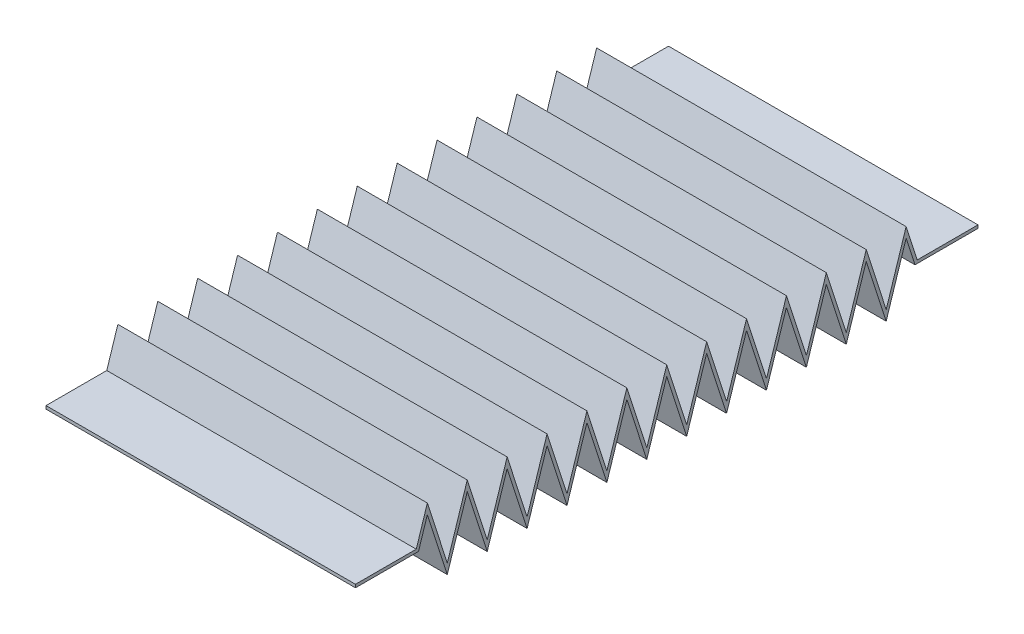
from build123d import *

# Parameters (mm, degrees)
EXTRUDE_THIN1_DEPTH = 25


with BuildPart() as part:
    # Sketch3 → Extrude-Thin1 (new, symmetric)
    with BuildSketch(Plane(origin=(0, 0, 0), x_dir=(0, 0, -1), z_dir=(1, 0, 0))):
        Polygon((0, 4.75), (10.182089669, 4.75), (11.611478161, 9.185022846), (14.834434482, -0.814977154), (18.057390803, 9.185022846), (21.280347124, -0.814977154), (24.503303445, 9.185022846), (27.726259766, -0.814977154), (30.949216087, 9.185022846), (34.172172408, -0.814977154), (37.395128729, 9.185022846), (40.61808505, -0.814977154), (43.841041371, 9.185022846), (47.063997692, -0.814977154), (50.286954014, 9.185022846), (53.509910335, -0.814977154), (56.732866656, 9.185022846), (59.955822977, -0.814977154), (63.178779298, 9.185022846), (66.401735619, -0.814977154), (69.62469194, 9.185022846), (72.847648261, -0.814977154), (76.070604582, 9.185022846), (79.293560903, -0.814977154), (82.516517224, 9.185022846), (85.739473545, -0.814977154), (88.962429867, 9.185022846), (90.391818358, 4.75), (100.573908027, 4.75), (100.573908027, 5.25), (90.755997696, 5.25), (88.962429867, 10.814977154), (85.739473545, 0.814977154), (82.516517224, 10.814977154), (79.293560903, 0.814977154), (76.070604582, 10.814977154), (72.847648261, 0.814977154), (69.62469194, 10.814977154), (66.401735619, 0.814977154), (63.178779298, 10.814977154), (59.955822977, 0.814977154), (56.732866656, 10.814977154), (53.509910335, 0.814977154), (50.286954014, 10.814977154), (47.063997692, 0.814977154), (43.841041371, 10.814977154), (40.61808505, 0.814977154), (37.395128729, 10.814977154), (34.172172408, 0.814977154), (30.949216087, 10.814977154), (27.726259766, 0.814977154), (24.503303445, 10.814977154), (21.280347124, 0.814977154), (18.057390803, 10.814977154), (14.834434482, 0.814977154), (11.611478161, 10.814977154), (9.817910331, 5.25), (0, 5.25), align=None)
    extrude(amount=EXTRUDE_THIN1_DEPTH, both=True)


solid = part.part
